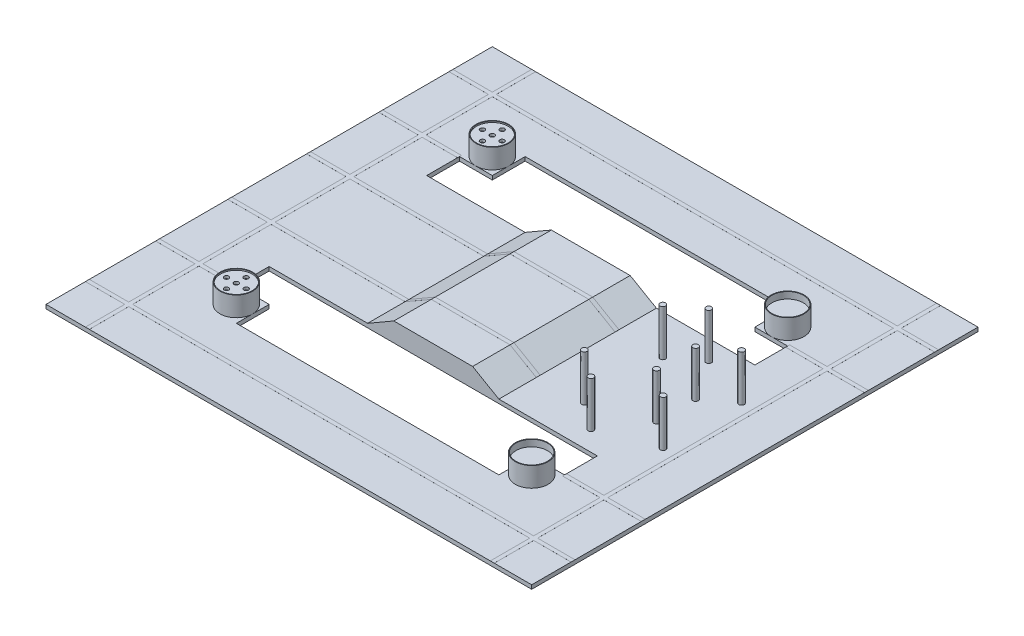
from build123d import *

# Parameters (mm, degrees)
SKETCH1_W               = 3700
SKETCH1_H               = 3400
BOSS_EXTRUDE1_DEPTH     = 30
BOSS_EXTRUDE2_DEPTH     = 600
SKETCH3_R               = 125
BOSS_EXTRUDE3_DEPTH     = 150
SKETCH4_R               = 120
CUT_EXTRUDE1_DEPTH      = 10
SKETCH5_R               = 17.5
CUT_EXTRUDE2_DEPTH      = 20
MIRROR3_COPY_1_SKETCH_R = 125
MIRROR3_COPY_1_DEPTH    = 150
MIRROR3_COPY_2_SKETCH_R = 120
MIRROR3_COPY_2_DEPTH    = 10
MIRROR3_COPY_3_SKETCH_R = 17.5
MIRROR3_COPY_3_DEPTH    = 20
MIRROR3_COPY_4_SKETCH_R = 125
MIRROR3_COPY_4_DEPTH    = 150
MIRROR3_COPY_5_SKETCH_R = 120
MIRROR3_COPY_5_DEPTH    = 10
MIRROR3_COPY_6_SKETCH_R = 17.5
MIRROR3_COPY_6_DEPTH    = 20
SKETCH6_R               = 120
CUT_EXTRUDE3_DEPTH      = 40
SKETCH7_W               = 300
SKETCH7_H               = 300
BOSS_EXTRUDE4_DEPTH     = 0.1
SKETCH8_W               = 3700
SKETCH8_H               = 30
SKETCH8_W_2             = 30
SKETCH8_H_2             = 3400
SKETCH8_W_3             = 600
SKETCH8_W_4             = 2350
EXTRUDE_THIN1_DEPTH     = 0.2
SKETCH9_W               = 230.740107676
SKETCH9_H               = 30
EXTRUDE_THIN2_DEPTH     = 0.1
SKETCH10_W              = 600
SKETCH10_H              = 30
EXTRUDE_THIN3_DEPTH     = 0.1
SKETCH11_R              = 21
BOSS_EXTRUDE5_DEPTH     = 350


with BuildPart() as part:
    # Sketch1 → Boss-Extrude1 (new body)
    with BuildSketch(Plane(origin=(0, 0, 0), x_dir=(1, 0, 0), z_dir=(0, 1, 0))):
        Rectangle(SKETCH1_W, SKETCH1_H)
        Polygon((-1250, -850), (-1250, -600), (1250, -600), (1250, -850), (1000, -850), (1000, -1100), (-1000, -1100), (-1000, -850), align=None, mode=Mode.SUBTRACT)
        Polygon((-1250, 600), (-1250, 850), (-1000, 850), (-1000, 1100), (1000, 1100), (1000, 850), (1250, 850), (1250, 600), align=None, mode=Mode.SUBTRACT)
    extrude(amount=BOSS_EXTRUDE1_DEPTH)

    # Sketch2 → Boss-Extrude2 (add, symmetric)
    with BuildSketch(Plane.XY):
        Polygon((-500, 30), (-300, 145.470053838), (300, 145.470053838), (500, 30), align=None)
    extrude(amount=BOSS_EXTRUDE2_DEPTH, both=True)

    # Sketch3 → Boss-Extrude3 (add)
    with BuildSketch(Plane(origin=(0, 30, 0), x_dir=(1, 0, 0), z_dir=(0, 1, 0))):
        with Locations((-1125, 975)):
            Circle(SKETCH3_R)
    boss_extrude3 = extrude(amount=BOSS_EXTRUDE3_DEPTH)

    # Sketch4 → Cut-Extrude1 (cut)
    with BuildSketch(Plane(origin=(0, 180, 0), x_dir=(1, 0, 0), z_dir=(0, 1, 0))):
        with Locations((-1125, 975)):
            Circle(SKETCH4_R)
    cut_extrude1 = extrude(amount=-CUT_EXTRUDE1_DEPTH, mode=Mode.SUBTRACT)

    # Sketch5 → Cut-Extrude2 (cut)
    with BuildSketch(Plane(origin=(0, 170, 0), x_dir=(1, 0, 0), z_dir=(0, 1, 0))):
        with Locations((-1125, 975)):
            Circle(SKETCH5_R)
        with Locations((-1050, 975)):
            Circle(SKETCH5_R)
        with Locations((-1125, 900)):
            Circle(SKETCH5_R)
        with Locations((-1200, 975)):
            Circle(SKETCH5_R)
        with Locations((-1125, 1050)):
            Circle(SKETCH5_R)
    cut_extrude2 = extrude(amount=-CUT_EXTRUDE2_DEPTH, mode=Mode.SUBTRACT)

    # Mirror2: Boss-Extrude3, Cut-Extrude1, Cut-Extrude2 across plane
    add(boss_extrude3.mirror(Plane.XY))
    add(cut_extrude1.mirror(Plane.XY), mode=Mode.SUBTRACT)
    add(cut_extrude2.mirror(Plane.XY), mode=Mode.SUBTRACT)

    # Mirror3 copy 1 sketch → Mirror3 copy 1 (add)
    with BuildSketch(Plane(origin=(0, 30, 0), x_dir=(-1, 0, 0), z_dir=(0, 1, 0))):
        with Locations((-1125, 975)):
            Circle(MIRROR3_COPY_1_SKETCH_R)
    extrude(amount=MIRROR3_COPY_1_DEPTH)

    # Mirror3 copy 2 sketch → Mirror3 copy 2 (cut)
    with BuildSketch(Plane(origin=(0, 180, 0), x_dir=(-1, 0, 0), z_dir=(0, 1, 0))):
        with Locations((-1125, 975)):
            Circle(MIRROR3_COPY_2_SKETCH_R)
    extrude(amount=-MIRROR3_COPY_2_DEPTH, mode=Mode.SUBTRACT)

    # Mirror3 copy 3 sketch → Mirror3 copy 3 (cut)
    with BuildSketch(Plane(origin=(0, 170, 0), x_dir=(-1, 0, 0), z_dir=(0, 1, 0))):
        with Locations((-1125, 975)):
            Circle(MIRROR3_COPY_3_SKETCH_R)
        with Locations((-1050, 975)):
            Circle(MIRROR3_COPY_3_SKETCH_R)
        with Locations((-1125, 900)):
            Circle(MIRROR3_COPY_3_SKETCH_R)
        with Locations((-1200, 975)):
            Circle(MIRROR3_COPY_3_SKETCH_R)
        with Locations((-1125, 1050)):
            Circle(MIRROR3_COPY_3_SKETCH_R)
    extrude(amount=-MIRROR3_COPY_3_DEPTH, mode=Mode.SUBTRACT)

    # Mirror3 copy 4 sketch → Mirror3 copy 4 (add)
    with BuildSketch(Plane(origin=(0, 30, 0), x_dir=(-1, 0, 0), z_dir=(0, 1, 0))):
        with Locations((-1125, -975)):
            Circle(MIRROR3_COPY_4_SKETCH_R)
    extrude(amount=MIRROR3_COPY_4_DEPTH)

    # Mirror3 copy 5 sketch → Mirror3 copy 5 (cut)
    with BuildSketch(Plane(origin=(0, 180, 0), x_dir=(-1, 0, 0), z_dir=(0, 1, 0))):
        with Locations((-1125, -975)):
            Circle(MIRROR3_COPY_5_SKETCH_R)
    extrude(amount=-MIRROR3_COPY_5_DEPTH, mode=Mode.SUBTRACT)

    # Mirror3 copy 6 sketch → Mirror3 copy 6 (cut)
    with BuildSketch(Plane(origin=(0, 170, 0), x_dir=(-1, 0, 0), z_dir=(0, 1, 0))):
        with Locations((-1125, -975)):
            Circle(MIRROR3_COPY_6_SKETCH_R)
        with Locations((-1050, -975)):
            Circle(MIRROR3_COPY_6_SKETCH_R)
        with Locations((-1125, -900)):
            Circle(MIRROR3_COPY_6_SKETCH_R)
        with Locations((-1200, -975)):
            Circle(MIRROR3_COPY_6_SKETCH_R)
        with Locations((-1125, -1050)):
            Circle(MIRROR3_COPY_6_SKETCH_R)
    extrude(amount=-MIRROR3_COPY_6_DEPTH, mode=Mode.SUBTRACT)

    # Sketch6 → Cut-Extrude3 (cut)
    with BuildSketch(Plane(origin=(0, 170, 0), x_dir=(1, 0, 0), z_dir=(0, 1, 0))):
        with Locations((1125, 975)):
            Circle(SKETCH6_R)
    cut_extrude3 = extrude(amount=-CUT_EXTRUDE3_DEPTH, mode=Mode.SUBTRACT)

    # Mirror4: Cut-Extrude3 across plane
    add(cut_extrude3.mirror(Plane.XY), mode=Mode.SUBTRACT)

    # Sketch7 → Boss-Extrude4 (add)
    with BuildSketch(Plane(origin=(0, 30, 0), x_dir=(1, 0, 0), z_dir=(0, 1, 0))):
        with Locations((-1700, 1550)):
            Rectangle(SKETCH7_W, SKETCH7_H)
        with Locations((-1700, -1550)):
            Rectangle(SKETCH7_W, SKETCH7_H)
    extrude(amount=BOSS_EXTRUDE4_DEPTH)

    # Sketch8 → Extrude-Thin1 (add)
    with BuildSketch(Plane(origin=(0, 30, 0), x_dir=(1, 0, 0), z_dir=(0, 1, 0))):
        with Locations((0, 1385)):
            Rectangle(SKETCH8_W, SKETCH8_H)
        with Locations((-1535, 0)):
            Rectangle(SKETCH8_W_2, SKETCH8_H_2)
        with Locations((1550, 0)):
            Rectangle(SKETCH8_W_2, SKETCH8_H_2)
        with Locations((-1550, 850)):
            Rectangle(SKETCH8_W_3, SKETCH8_H)
        with Locations((-675, 300)):
            Rectangle(SKETCH8_W_4, SKETCH8_H)
        with Locations((-675, -300)):
            Rectangle(SKETCH8_W_4, SKETCH8_H)
        with Locations((0, -1385)):
            Rectangle(SKETCH8_W, SKETCH8_H)
        with Locations((-1550, -850)):
            Rectangle(SKETCH8_W_3, SKETCH8_H)
        with Locations((1550, 850)):
            Rectangle(SKETCH8_W_3, SKETCH8_H)
        with Locations((1550, -850)):
            Rectangle(SKETCH8_W_3, SKETCH8_H)
    extrude(amount=EXTRUDE_THIN1_DEPTH)

    # Sketch9 → Extrude-Thin2 (add)
    with BuildSketch(Plane(origin=(-137.990381057, 239.006350946, 0), x_dir=(0.8660254037844415, 0.4999999999999951, 0), z_dir=(-0.49999999999999517, 0.8660254037844416, 0))):
        with Locations((-302.442648054, 300)):
            Rectangle(SKETCH9_W, SKETCH9_H)
        with Locations((-302.442648054, -300)):
            Rectangle(SKETCH9_W, SKETCH9_H)
    extrude_thin2 = extrude(amount=EXTRUDE_THIN2_DEPTH)

    # Sketch10 → Extrude-Thin3 (add)
    with BuildSketch(Plane(origin=(0, 145.470053838, 0), x_dir=(1, 0, 0), z_dir=(0, 1, 0))):
        with Locations((0, 300)):
            Rectangle(SKETCH10_W, SKETCH10_H)
        with Locations((0, -300)):
            Rectangle(SKETCH10_W, SKETCH10_H)
    extrude(amount=EXTRUDE_THIN3_DEPTH)

    # Mirror5: Extrude-Thin2 across plane
    add(extrude_thin2.mirror(Plane(origin=(0, 0, 0), x_dir=(0, 0, 1), z_dir=(1, 0, 0))))

    # Sketch11 → Boss-Extrude5 (add)
    with BuildSketch(Plane(origin=(0, 30, 0), x_dir=(1, 0, 0), z_dir=(0, 1, 0))):
        with Locations((850, -298.836957303)):
            Circle(SKETCH11_R)
        with Locations((1050, -448.836957303)):
            Circle(SKETCH11_R)
        with Locations((1450, -298.836957303)):
            Circle(SKETCH11_R)
        with Locations((1250, -148.836957303)):
            Circle(SKETCH11_R)
    boss_extrude5 = extrude(amount=BOSS_EXTRUDE5_DEPTH)

    # Mirror6: Boss-Extrude5 across plane
    add(boss_extrude5.mirror(Plane.XY))


solid = part.part
